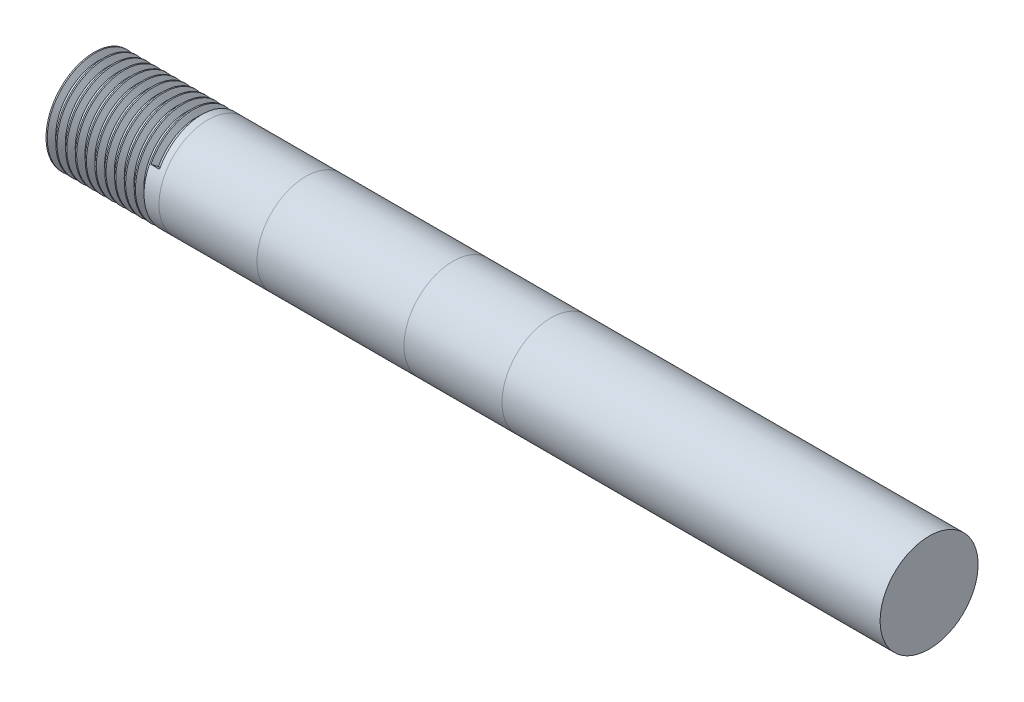
from build123d import *

# Parameters (mm, degrees)
SKETCH1_W     = 108.56254009
SKETCH1_H     = 6.35
THREAD1_PITCH = 1.27


with BuildPart() as part:
    # Sketch1 → Revolve1 (revolve)
    with BuildSketch(Plane.XY, mode=Mode.PRIVATE) as revolve1_sk:
        with Locations((54.281270045, 3.175)):
            Rectangle(SKETCH1_W, SKETCH1_H)
    revolve(revolve1_sk.sketch.rotate(Axis((-315.96266582, 0, 0), (1, 0, 0)), 90), axis=Axis((-315.96266582, 0, 0), (1, 0, 0)))

    # Thread1: the profile of Thread Profile1 profile screwed along a right-hand helix of 11.417323 turns, 8 arcs to a turn; built about Z, then put on its axis
    thread1_z = Axis((0, 0, 0), (0, 0, 1))
    thread1_corners = [(6.3503, 0, -0.000173205), (6.3503, 0, 1.111423202), (5.662592339, 0, 0.714374998), (5.662592339, 0, 0.396874998)]
    with BuildLine(mode=Mode.PRIVATE) as thread1_profile:
        Line(thread1_corners[0], thread1_corners[1])
        Line(thread1_corners[1], thread1_corners[2])
        Line(thread1_corners[2], thread1_corners[3])
        Line(thread1_corners[3], thread1_corners[0])
    thread1_cap = Face(thread1_profile.wire())
    thread1_turn_angles = [0, 22.5, 45, 67.5, 90, 112.5, 135, 157.5, 180, 202.5, 225, 247.5, 270, 292.5, 315, 337.5, 360]
    thread1_turn_weights = [1, 0.9238795325112867, 1, 0.9238795325112867, 1, 0.9238795325112867, 1, 0.9238795325112867, 1, 0.9238795325112867, 1, 0.9238795325112867, 1, 0.9238795325112867, 1, 0.9238795325112867, 1]
    thread1_turn_rails = [Edge.make_bspline([Vector(p[0], p[1], 0).rotate(thread1_z, thread1_turn_angles[k]) / thread1_turn_weights[k] + Vector(0, 0, p[2] + THREAD1_PITCH * thread1_turn_angles[k] / 360) for k in range(17)], [0, 0, 0, 1, 1, 2, 2, 3, 3, 4, 4, 5, 5, 6, 6, 7, 7, 8, 8, 8], 2, thread1_turn_weights) for p in thread1_corners]
    thread1_turn_sides = [Face.make_surface_from_curves(thread1_turn_rails[p[0]], thread1_turn_rails[p[1]]) for p in [(0, 1), (1, 2), (2, 3), (3, 0)]]
    thread1_last_angles = [3960, 3982.5, 4005, 4027.5, 4050, 4072.5, 4095, 4102.618110236, 4110.236220472]
    thread1_last_weights = [1, 0.9238795325112867, 1, 0.9238795325112867, 1, 0.9238795325112867, 1, 0.9911736867070363, 1]
    thread1_last_rails = [Edge.make_bspline([Vector(p[0], p[1], 0).rotate(thread1_z, thread1_last_angles[k]) / thread1_last_weights[k] + Vector(0, 0, p[2] + THREAD1_PITCH * thread1_last_angles[k] / 360) for k in range(9)], [0, 0, 0, 1, 1, 2, 2, 3, 3, 4, 4, 4], 2, thread1_last_weights) for p in thread1_corners]
    thread1_last_sides = [Face.make_surface_from_curves(thread1_last_rails[p[0]], thread1_last_rails[p[1]]) for p in [(0, 1), (1, 2), (2, 3), (3, 0)]]
    thread1 = Plane(origin=(-1.27, 0, 0), x_dir=(0, 0, -1), z_dir=(1, 0, 0)) * Solid(Shell([*[p.moved(Location((0, 0, THREAD1_PITCH * i))) for i in range(11) for p in thread1_turn_sides], *thread1_last_sides, thread1_cap, thread1_cap.rotate(thread1_z, 4110.236220472).moved(Location((0, 0, THREAD1_PITCH * 4110.236220472 / 360)))]))
    add(thread1, mode=Mode.SUBTRACT)


solid = part.part
